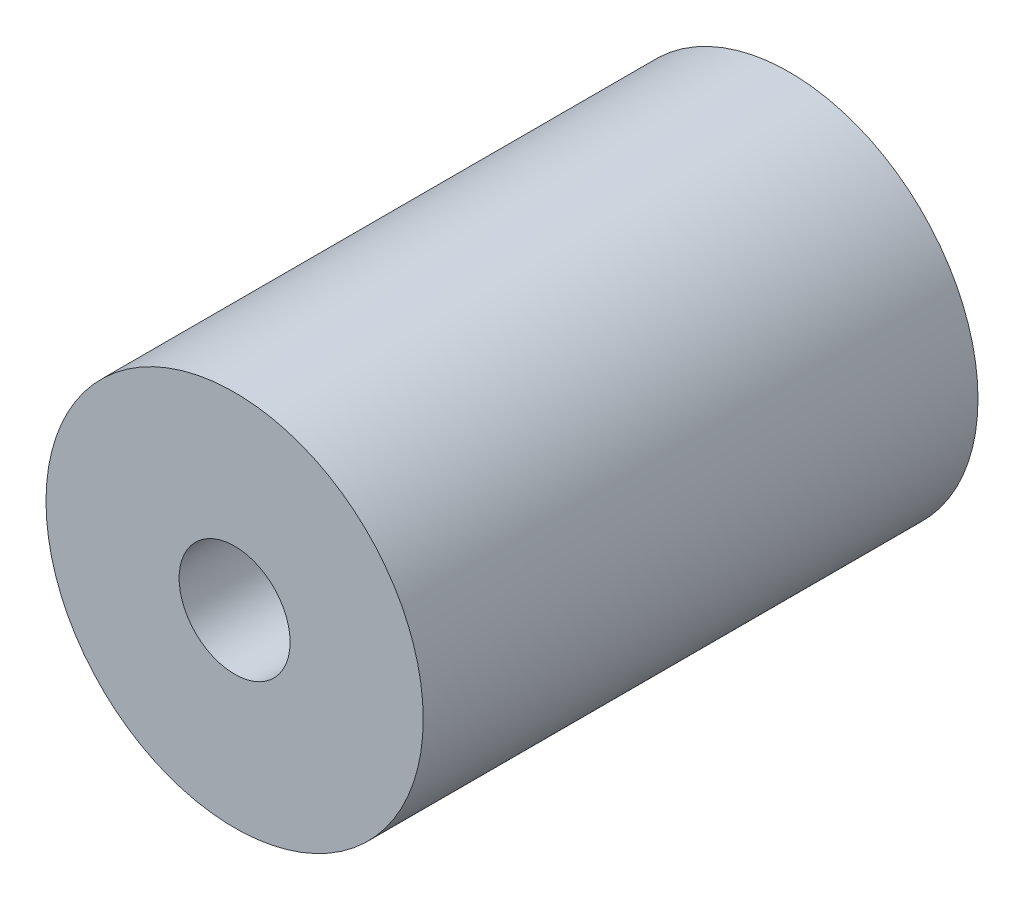
from build123d import *

# Parameters (mm, degrees)
SKETCH1_R           = 8.5
SKETCH1_R_2         = 2.5
BOSS_EXTRUDE1_DEPTH = 12.5


with BuildPart() as part:
    # Sketch1 → Boss-Extrude1 (new, symmetric)
    with BuildSketch(Plane.XY):
        Circle(SKETCH1_R)
        Circle(SKETCH1_R_2, mode=Mode.SUBTRACT)
    extrude(amount=BOSS_EXTRUDE1_DEPTH, both=True)


solid = part.part
